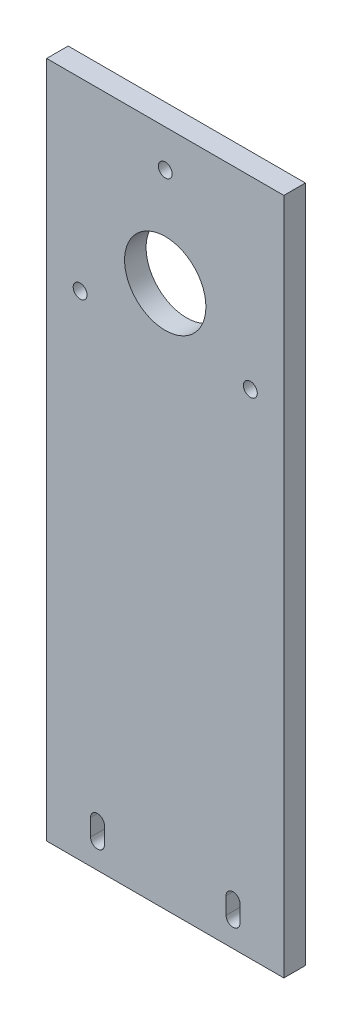
from build123d import *

# Parameters (mm, degrees)
SKETCH1_W           = 70
SKETCH1_H           = 200
SKETCH1_R           = 2.05
SKETCH1_R_2         = 12
BOSS_EXTRUDE1_DEPTH = 6.35


with BuildPart() as part:
    # Sketch1 → Boss-Extrude1 (new body)
    with BuildSketch(Plane.XY):
        Rectangle(SKETCH1_W, SKETCH1_H)
        with Locations((0, 89)):
            Circle(SKETCH1_R, mode=Mode.SUBTRACT)
        with Locations((25.11473671, 45.5)):
            Circle(SKETCH1_R, mode=Mode.SUBTRACT)
        with Locations((-25.11473671, 45.5)):
            Circle(SKETCH1_R, mode=Mode.SUBTRACT)
        with Locations((0, 60)):
            Circle(SKETCH1_R_2, mode=Mode.SUBTRACT)
        with BuildLine():
            Line((-22.05, -92.5), (-22.05, -87.5))
            ThreePointArc((-22.05, -87.5), (-20, -85.45), (-17.95, -87.5))
            Line((-17.95, -87.5), (-17.95, -92.5))
            ThreePointArc((-17.95, -92.5), (-20, -94.55), (-22.05, -92.5))
        make_face(mode=Mode.SUBTRACT)
        with BuildLine():
            Line((22.05, -92.5), (22.05, -87.5))
            ThreePointArc((22.05, -87.5), (20, -85.45), (17.95, -87.5))
            Line((17.95, -87.5), (17.95, -92.5))
            ThreePointArc((17.95, -92.5), (20, -94.55), (22.05, -92.5))
        make_face(mode=Mode.SUBTRACT)
    extrude(amount=BOSS_EXTRUDE1_DEPTH)


solid = part.part
